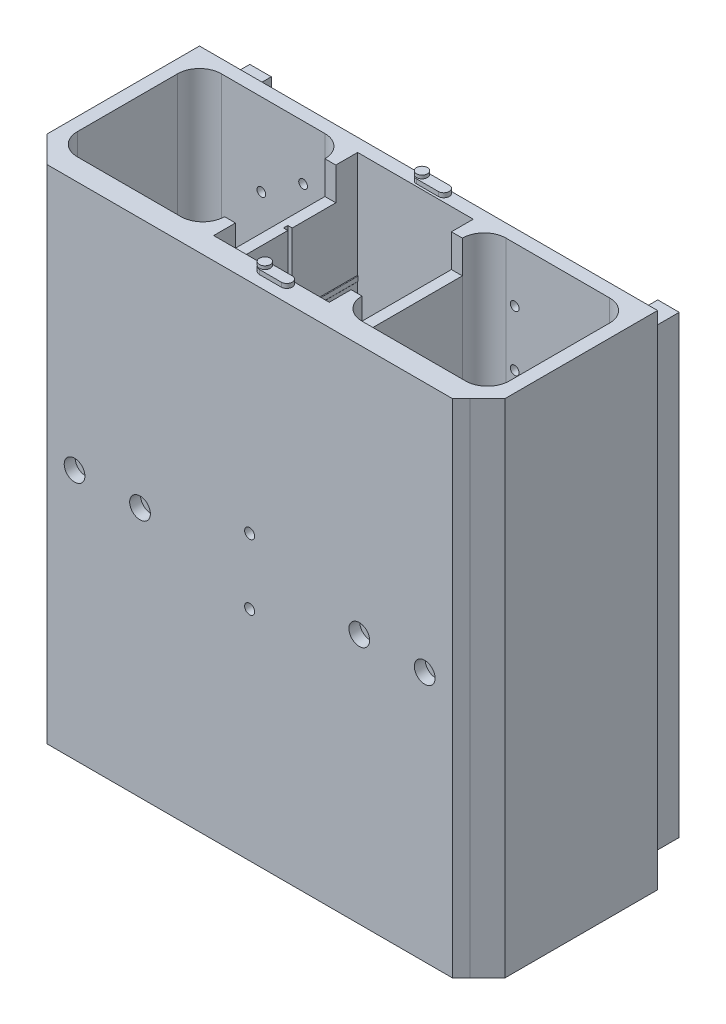
from build123d import *

# Parameters (mm, degrees)
SKETCH_1_W           = 210
SKETCH_1_H           = 230
EXTRUDE_1_DEPTH      = 6
SKETCH_2_W           = 9.85
SKETCH_2_H           = 208.5
EXTRUDE_3_DEPTH      = 15
SKETCH_3_R           = 2
CUT_EXTRUDE_1_DEPTH  = 10
SKETCH_17_W          = 6
SKETCH_17_H          = 230
EXTRUDE_9_DEPTH      = 66
EXTRUDE_10_DEPTH     = 6
CHAMFER_3_SIZE       = 8
SKETCH_19_W          = 5
SKETCH_19_H          = 230
EXTRUDE_11_DEPTH     = 66
FILLET_4_R           = 10
SKETCH_21_R          = 2.3
CUT_EXTRUDE_9_DEPTH  = 6
EXTRUDE_13_DEPTH     = 66
SKETCH_28_W          = 53
SKETCH_28_H          = 3
EXTRUDE_14_DEPTH     = 66
SKETCH_30_W          = 2
SKETCH_30_H          = 2
CUT_EXTRUDE_10_DEPTH = 35
SKETCH_31_R          = 1.35
SKETCH_31_W          = 14
SKETCH_31_H          = 14
CUT_EXTRUDE_11_DEPTH = 316.06185361
SKETCH_34_R          = 2.25
CUT_EXTRUDE_14_DEPTH = 30
SKETCH_36_R          = 2.25
CUT_EXTRUDE_15_DEPTH = 30
SKETCH_39_W          = 46
SKETCH_39_H          = 15
CUT_EXTRUDE_16_DEPTH = 104
SKETCH_40_R          = 1.5
EXTRUDE_16_DEPTH     = 3
SKETCH_41_R          = 2.5
EXTRUDE_17_DEPTH     = 1.5
SKETCH_44_R          = 1.62
EXTRUDE_19_DEPTH     = 2
SKETCH_46_R          = 1.62
EXTRUDE_20_DEPTH     = 2
SKETCH_49_W          = 12
SKETCH_49_H          = 8.46
CUT_EXTRUDE_17_DEPTH = 10
SKETCH_50_W          = 20
SKETCH_50_H          = 8.46
CUT_EXTRUDE_18_DEPTH = 10
SKETCH_51_W          = 194
SKETCH_51_H          = 230
EXTRUDE_22_DEPTH     = 4
CHAMFER_6_SIZE       = 4
CUT_EXTRUDE_START    = -5
SKETCH_54_R          = 4.75
SKETCH_54_R_2        = 2.3
CUT_EXTRUDE_21_DEPTH = 5


with BuildPart() as part:
    # 草图1 → 凸台-拉伸1 (new body)
    with BuildSketch(Plane.XY):
        with Locations((105, 115)):
            Rectangle(SKETCH_1_W, SKETCH_1_H)
    extrude(amount=EXTRUDE_1_DEPTH)

    # 草图2 → 凸台-拉伸3 (add)
    with BuildSketch(Plane(origin=(0, 0, 0), x_dir=(-1, 0, 0), z_dir=(0, 0, -1))):
        with Locations((-200, 115)):
            Rectangle(SKETCH_2_W, SKETCH_2_H)
        with Locations((-13, 115)):
            Rectangle(SKETCH_2_W, SKETCH_2_H)
    extrude(amount=EXTRUDE_3_DEPTH)

    # 草图3 → 切除-拉伸1 (cut)
    with BuildSketch(Plane(origin=(0, 0, 0), x_dir=(-1, 0, 0), z_dir=(0, 0, -1))):
        with Locations((-169.6425573, 192.25)):
            Circle(SKETCH_3_R)
        with Locations((-150.5, 205)):
            Circle(SKETCH_3_R)
        with Locations((-150.5, 179.5)):
            Circle(SKETCH_3_R)
        with Locations(Location((-150.5, 50.5, 0), (0, 0, 180))):
            Circle(SKETCH_3_R)
        with Locations(Location((-150.5, 25, 0), (0, 0, 180))):
            Circle(SKETCH_3_R)
        with Locations(Location((-169.6425573, 37.75, 0), (0, 0, 180))):
            Circle(SKETCH_3_R)
        with Locations((-34.3574427, 192.25)):
            Circle(SKETCH_3_R)
        with Locations((-53.5, 205)):
            Circle(SKETCH_3_R)
        with Locations((-53.5, 179.5)):
            Circle(SKETCH_3_R)
        with Locations(Location((-53.5, 50.5, 0), (0, 0, 180))):
            Circle(SKETCH_3_R)
        with Locations(Location((-53.5, 25, 0), (0, 0, 180))):
            Circle(SKETCH_3_R)
        with Locations(Location((-34.3574427, 37.75, 0), (0, 0, 180))):
            Circle(SKETCH_3_R)
    extrude(amount=-CUT_EXTRUDE_1_DEPTH, mode=Mode.SUBTRACT)

    # 草图17 → 凸台-拉伸9 (add)
    with BuildSketch(Plane.XY.offset(6)):
        with Locations((3, 115)):
            Rectangle(SKETCH_17_W, SKETCH_17_H)
        with Locations((207, 115)):
            Rectangle(SKETCH_17_W, SKETCH_17_H)
    extrude(amount=EXTRUDE_9_DEPTH)

    # 草图18 → 凸台-拉伸10 (add)
    with BuildSketch(Plane.XY.offset(72)):
        Polygon((210, 230), (204, 230), (6, 230), (0, 230), (0, 0), (6, 0), (204, 0), (210, 0), align=None)
    extrude(amount=EXTRUDE_10_DEPTH)

    # 倒角3
    chamfer_3_edges = [part.edges().sort_by_distance(p)[0] for p in [
        (210, 115, 78),
        (0, 115, 78),
    ]]
    chamfer(chamfer_3_edges, length=CHAMFER_3_SIZE)

    # 草图19 → 凸台-拉伸11 (add)
    with BuildSketch(Plane(origin=(0, 0, 72), x_dir=(-1, 0, 0), z_dir=(0, 0, -1))):
        with Locations((-134, 115)):
            Rectangle(SKETCH_19_W, SKETCH_19_H)
        with Locations((-76, 115)):
            Rectangle(SKETCH_19_W, SKETCH_19_H)
    extrude(amount=EXTRUDE_11_DEPTH)

    # 圆角4
    fillet_4_edges = [part.edges().sort_by_distance(p)[0] for p in [
        (6, 115, 6),
        (6, 115, 72),
        (204, 115, 6),
        (204, 115, 72),
        (73.5, 115, 6),
        (73.5, 115, 72),
        (136.5, 115, 72),
        (136.5, 115, 6),
    ]]
    fillet(fillet_4_edges, radius=FILLET_4_R)

    # 草图21 → 切除-拉伸9 (cut)
    with BuildSketch(Plane.XY.offset(72)):
        with Locations((105, 130)):
            Circle(SKETCH_21_R)
        with Locations((105, 100)):
            Circle(SKETCH_21_R)
    extrude(amount=CUT_EXTRUDE_9_DEPTH, mode=Mode.SUBTRACT)

    # 草图26 → 凸台-拉伸13 (add)
    with BuildSketch(Plane(origin=(0, 0, 72), x_dir=(-1, 0, 0), z_dir=(0, 0, -1))):
        with BuildLine():
            Line((-131.26, 181), (-131.26, 179))
            ThreePointArc((-131.26, 179), (-131.5, 178.76), (-131.74, 179))
            Line((-131.74, 179), (-131.74, 181))
            ThreePointArc((-131.74, 181), (-131.5, 181.24), (-131.26, 181))
        make_face()
        with BuildLine():
            Line((-131.26, 22.5), (-131.26, 20.5))
            ThreePointArc((-131.26, 20.5), (-131.5, 20.26), (-131.74, 20.5))
            Line((-131.74, 20.5), (-131.74, 22.5))
            ThreePointArc((-131.74, 22.5), (-131.5, 22.74), (-131.26, 22.5))
        make_face()
    extrude_13 = extrude(amount=EXTRUDE_13_DEPTH)

    # 镜向2: 凸台-拉伸13 across plane
    add(extrude_13.mirror(Plane.ZY.offset(-105)))

    # 草图28 → 凸台-拉伸14 (add)
    with BuildSketch(Plane(origin=(0, 0, 72), x_dir=(-1, 0, 0), z_dir=(0, 0, -1))):
        with Locations((-105, 9.96)):
            Rectangle(SKETCH_28_W, SKETCH_28_H)
    extrude(amount=EXTRUDE_14_DEPTH)

    # 草图30 → 切除-拉伸10 (cut)
    with BuildSketch(Plane(origin=(0, 230, 0), x_dir=(1, 0, 0), z_dir=(0, 1, 0))):
        with Locations((77.5, -37)):
            Rectangle(SKETCH_30_W, SKETCH_30_H)
    extrude(amount=-CUT_EXTRUDE_10_DEPTH, mode=Mode.SUBTRACT)

    # 草图31 → 切除-拉伸11 (cut, through all)
    with BuildSketch(Plane.XZ.offset(-8.46)):
        with Locations((92.7, 16.2)):
            Circle(SKETCH_31_R)
        with Locations((117.3, 16.2)):
            Circle(SKETCH_31_R)
        with Locations((105, 16.2)):
            Rectangle(SKETCH_31_W, SKETCH_31_H)
    extrude(amount=-CUT_EXTRUDE_11_DEPTH, mode=Mode.SUBTRACT)

    # 草图34 → 切除-拉伸14 (cut)
    with BuildSketch(Plane(origin=(0, 0, 72), x_dir=(-1, 0, 0), z_dir=(0, 0, -1))):
        with Locations((-185.25, 115)):
            Circle(SKETCH_34_R)
        with Locations((-155.25, 115)):
            Circle(SKETCH_34_R)
    extrude(amount=-CUT_EXTRUDE_14_DEPTH, mode=Mode.SUBTRACT)

    # 草图36 → 切除-拉伸15 (cut)
    with BuildSketch(Plane(origin=(0, 0, 72), x_dir=(-1, 0, 0), z_dir=(0, 0, -1))):
        with Locations((-54.75, 115)):
            Circle(SKETCH_36_R)
        with Locations((-24.75, 115)):
            Circle(SKETCH_36_R)
    extrude(amount=-CUT_EXTRUDE_15_DEPTH, mode=Mode.SUBTRACT)

    # 草图39 → 切除-拉伸16 (cut)
    with BuildSketch(Plane.ZY.offset(-73.5)):
        with Locations((39, 222.5)):
            Rectangle(SKETCH_39_W, SKETCH_39_H)
    extrude(amount=-CUT_EXTRUDE_16_DEPTH, mode=Mode.SUBTRACT)

    # 草图40 → 凸台-拉伸16 (add)
    with BuildSketch(Plane(origin=(0, 230, 0), x_dir=(1, 0, 0), z_dir=(0, 1, 0))):
        with Locations(Location((105, -3, 0), (0, 0, 270))):
            Circle(SKETCH_40_R)
    extrude_16 = extrude(amount=EXTRUDE_16_DEPTH)

    # 草图41 → 凸台-拉伸17 (add)
    with BuildSketch(Plane(origin=(0, 233, 0), x_dir=(1, 0, 0), z_dir=(0, 1, 0))):
        with Locations(Location((105, -3, 0), (0, 0, 270))):
            Circle(SKETCH_41_R)
    extrude_17 = extrude(amount=EXTRUDE_17_DEPTH)

    # 镜向3: 凸台-拉伸16, 凸台-拉伸17 across plane
    add(extrude_16.mirror(Plane.XY.offset(39)))
    add(extrude_17.mirror(Plane.XY.offset(39)))

    # 草图49 → 切除-拉伸17 (cut)
    with BuildSketch(Plane.XY.offset(6)):
        with Locations((84.5, 4.23)):
            Rectangle(SKETCH_49_W, SKETCH_49_H)
    extrude(amount=-CUT_EXTRUDE_17_DEPTH, mode=Mode.SUBTRACT)

    # 草图50 → 切除-拉伸18 (cut)
    with BuildSketch(Plane(origin=(78.5, 0, 0), x_dir=(0, 0, -1), z_dir=(1, 0, 0))):
        with Locations((-40, 4.23)):
            Rectangle(SKETCH_50_W, SKETCH_50_H)
    extrude(amount=-CUT_EXTRUDE_18_DEPTH, mode=Mode.SUBTRACT)

    # 草图51 → 凸台-拉伸22 (add)
    with BuildSketch(Plane.XY.offset(78)):
        with Locations((105, 115)):
            Rectangle(SKETCH_51_W, SKETCH_51_H)
    extrude(amount=EXTRUDE_22_DEPTH)

    # 倒角6
    chamfer_6_edges = [part.edges().sort_by_distance(p)[0] for p in [
        (202, 115, 82),
        (8, 115, 82),
    ]]
    chamfer(chamfer_6_edges, length=CHAMFER_6_SIZE - 0.0001)  # a hair under: the kernel refuses the full size

    # 草图54 → 切除-拉伸21 (cut)
    with BuildSketch(Plane.XY.offset(82).offset(CUT_EXTRUDE_START)):
        with Locations((54.75, 115)):
            Circle(SKETCH_54_R)
        with Locations((105, 130)):
            Circle(SKETCH_54_R_2)
        with Locations((105, 100)):
            Circle(SKETCH_54_R_2)
        with Locations((24.75, 115)):
            Circle(SKETCH_54_R)
        with Locations((155.25, 115)):
            Circle(SKETCH_54_R)
        with Locations((185.25, 115)):
            Circle(SKETCH_54_R)
    extrude(amount=CUT_EXTRUDE_21_DEPTH, mode=Mode.SUBTRACT)


with BuildPart() as body_2:
    # 草图44 → 凸台-拉伸19 (new body)
    with BuildSketch(Plane(origin=(0, 230.5, 0), x_dir=(1, 0, 0), z_dir=(0, 1, 0))):
        with BuildLine():
            Line((105, -0.5), (115, -0.5))
            ThreePointArc((115, -0.5), (117.5, -3), (115, -5.5))
            Line((115, -5.5), (105, -5.5))
            ThreePointArc((105, -5.5), (102.5, -3), (105, -0.5))
        make_face()
        with Locations(Location((105, -3, 0), (0, 0, 270))):
            Circle(SKETCH_44_R, mode=Mode.SUBTRACT)
    extrude(amount=EXTRUDE_19_DEPTH)


with BuildPart() as body_3:
    # 草图46 → 凸台-拉伸20 (new body)
    with BuildSketch(Plane(origin=(0, 230.5, 0), x_dir=(1, 0, 0), z_dir=(0, 1, 0))):
        with BuildLine():
            Line((115, -72.5), (105, -72.5))
            ThreePointArc((105, -72.5), (102.5, -75), (105, -77.5))
            Line((105, -77.5), (115, -77.5))
            ThreePointArc((115, -77.5), (117.5, -75), (115, -72.5))
        make_face()
        with Locations(Location((105, -75, 0), (0, 0, 270))):
            Circle(SKETCH_46_R, mode=Mode.SUBTRACT)
    extrude(amount=EXTRUDE_20_DEPTH)


solid = Compound([part.part, body_2.part, body_3.part])
